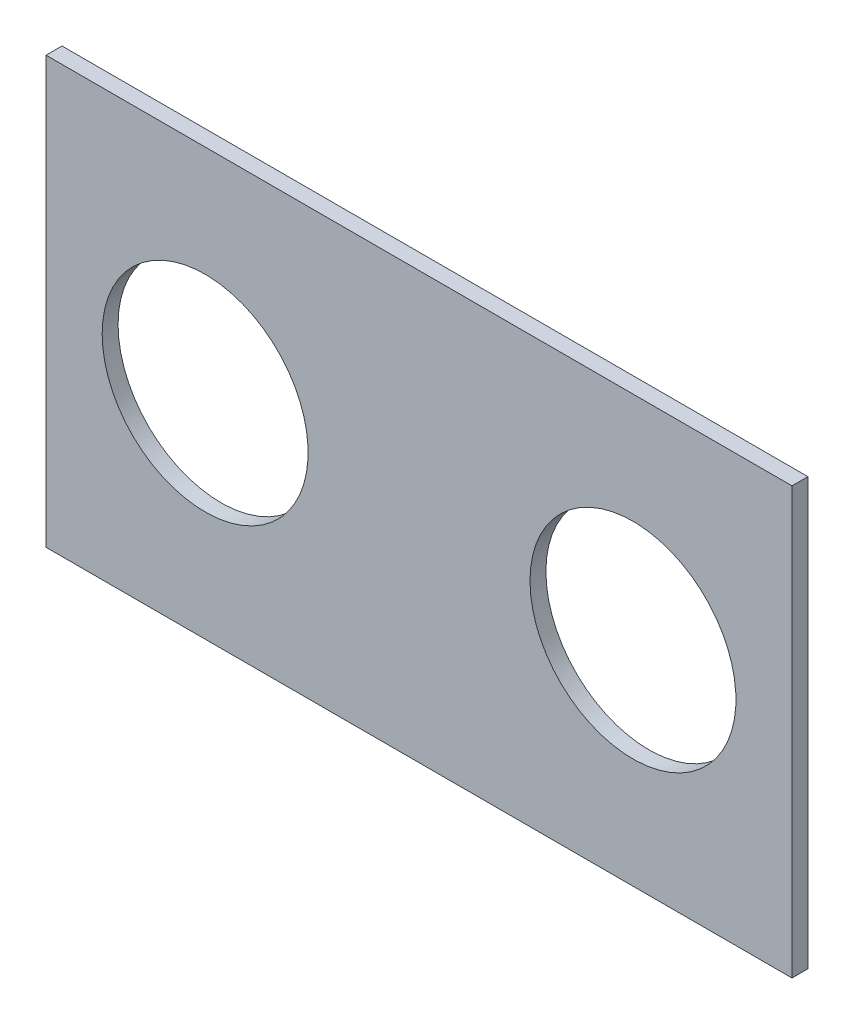
from build123d import *

# Parameters (mm, degrees)
SKETCH1_W           = 88.9
SKETCH1_H           = 50.8
SKETCH1_R           = 12.272596154
BOSS_EXTRUDE1_DEPTH = 1.89738


with BuildPart() as part:
    # Sketch1 → Boss-Extrude1 (new body)
    with BuildSketch(Plane.XY):
        with Locations((25.49525, 0)):
            Rectangle(SKETCH1_W, SKETCH1_H)
        Circle(SKETCH1_R, mode=Mode.SUBTRACT)
        with Locations((50.9905, 0)):
            Circle(SKETCH1_R, mode=Mode.SUBTRACT)
    extrude(amount=BOSS_EXTRUDE1_DEPTH)


solid = part.part
